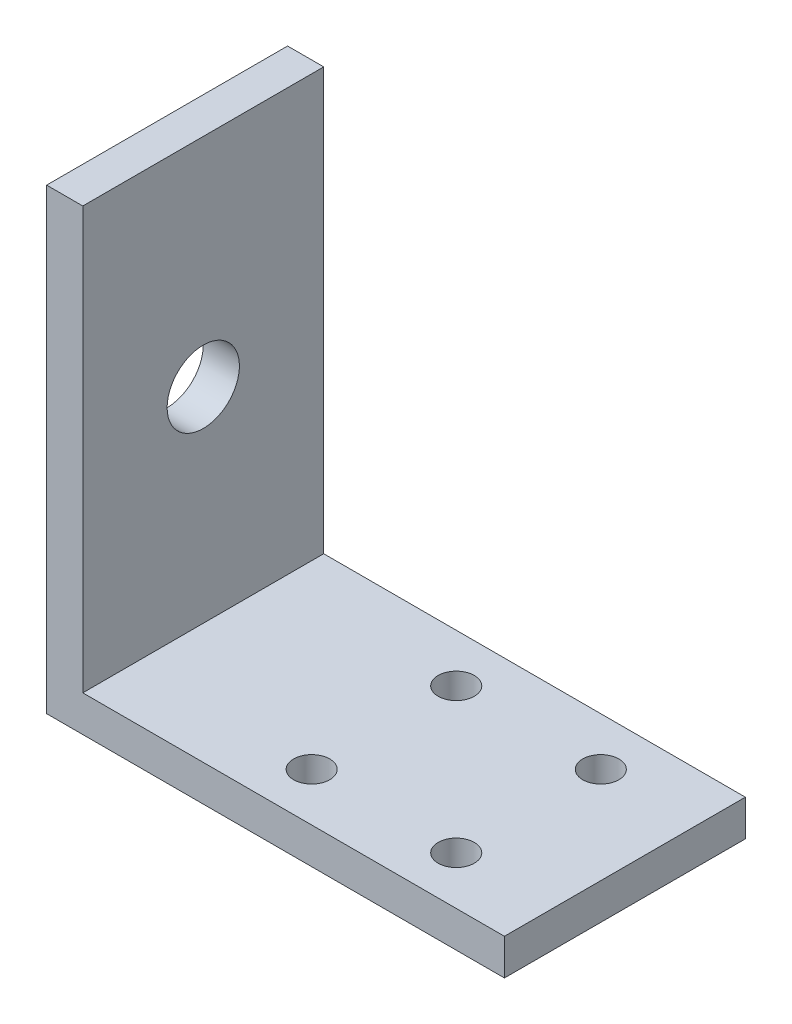
from build123d import *

# Parameters (mm, degrees)
EXTRUDE_1_DEPTH     = 20
SKETCH_2_R          = 3
CUT_EXTRUDE_1_DEPTH = 58.341084747
SKETCH_3_R          = 1.5
CUT_EXTRUDE_2_DEPTH = 56.398555938


with BuildPart() as part:
    # 草图1 → 凸台-拉伸1 (new body)
    with BuildSketch(Plane.XY):
        Polygon((0, 0), (0, 38), (3, 38), (3, 3), (38, 3), (38, 0), align=None)
    extrude(amount=EXTRUDE_1_DEPTH)

    # 草图2 → 切除-拉伸1 (cut, through all)
    with BuildSketch(Plane.ZY):
        with Locations((10, 20)):
            Circle(SKETCH_2_R)
    extrude(amount=-CUT_EXTRUDE_1_DEPTH, mode=Mode.SUBTRACT)

    # 草图3 → 切除-拉伸2 (cut, through all)
    with BuildSketch(Plane(origin=(0, 3, 0), x_dir=(1, 0, 0), z_dir=(0, 1, 0))):
        with Locations((18, -4)):
            Circle(SKETCH_3_R)
        with Locations((18, -16)):
            Circle(SKETCH_3_R)
        with Locations((30, -4)):
            Circle(SKETCH_3_R)
        with Locations((30, -16)):
            Circle(SKETCH_3_R)
    extrude(amount=-CUT_EXTRUDE_2_DEPTH, mode=Mode.SUBTRACT)


solid = part.part
